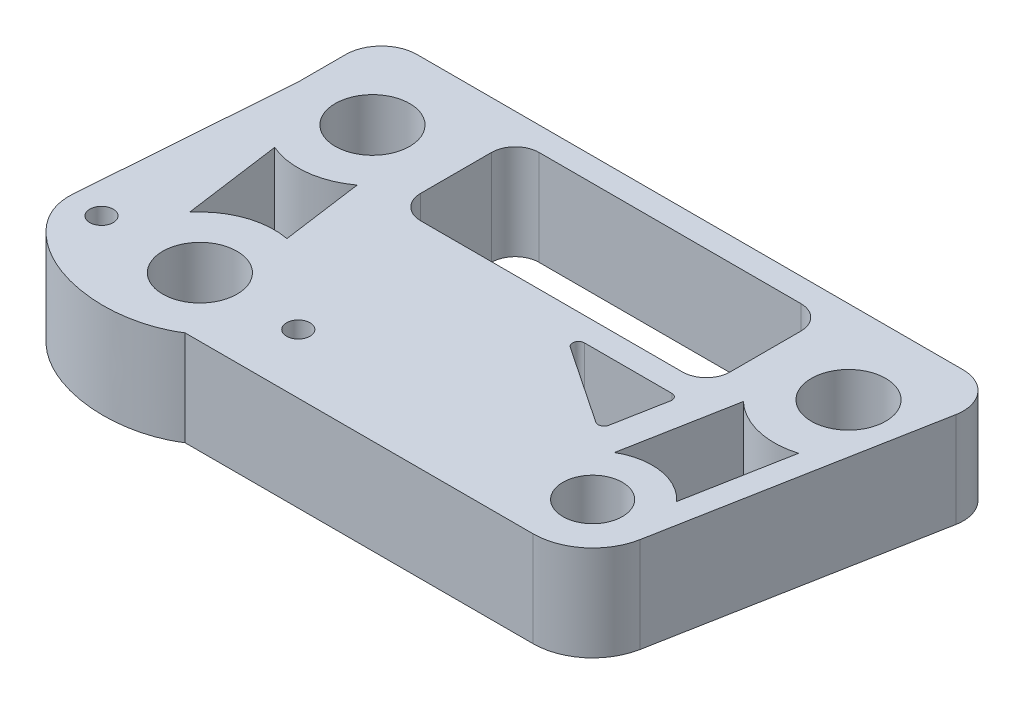
from build123d import *

# Parameters (mm, degrees)
SKETCH4_R           = 3.96875
SKETCH4_R_2         = 3.175
SKETCH4_R_3         = 1.25
BOSS_EXTRUDE2_DEPTH = 10.16
SKETCH6_R           = 5.05
CUT_EXTRUDE1_DEPTH  = 3.3
FILLET1_R           = 3.81


with BuildPart() as part:
    # Sketch4 → Boss-Extrude2 (new body)
    with BuildSketch(Plane(origin=(0, 0, 0), x_dir=(1, 0, 0), z_dir=(0, 1, 0))):
        with BuildLine():
            Line((54.2925, 31.75), (-12.3825, 31.75))
            Line((-12.3825, 31.75), (-12.3825, 22.86))
            Line((-12.3825, 22.86), (-14.03894274, 0.53216308))
            add(Edge.make_bspline(
                [(-14.03894274, 0.53216308), (-14.196581641, -1.592713076), (-10.175970279, -8.364307775), (0.040816901, -9.386271273), (4.7625, -6.35)],
                knots=[0, 0, 0, 0, 0.247792149, 1, 1, 1, 1], degree=3))
            Line((4.7625, -6.35), (41.91, -6.35))
            ThreePointArc((41.91, -6.35), (45.967580476, -4.884520517), (48.152310263, -1.164501002))
            Line((48.152310263, -1.164501002), (54.2925, 31.75))
        make_face()
        Circle(SKETCH4_R, mode=Mode.SUBTRACT)
        with Locations((46.355, 22.86)):
            Circle(SKETCH4_R, mode=Mode.SUBTRACT)
        with Locations((-4.445, 22.86)):
            Circle(SKETCH4_R, mode=Mode.SUBTRACT)
        with Locations((41.91, 0)):
            Circle(SKETCH4_R_2, mode=Mode.SUBTRACT)
        with Locations((10.5, 0)):
            Circle(SKETCH4_R_3, mode=Mode.SUBTRACT)
        with Locations((-10.5, 0)):
            Circle(SKETCH4_R_3, mode=Mode.SUBTRACT)
        with BuildLine():
            Line((34.925, 29.21), (6.985, 29.21))
            ThreePointArc((6.985, 29.21), (5.188948776, 28.466051224), (4.445, 26.67))
            Line((4.445, 26.67), (4.445, 19.1135))
            ThreePointArc((4.445, 19.1135), (5.188948776, 17.317448776), (6.985, 16.5735))
            Line((6.985, 16.5735), (34.925, 16.5735))
            ThreePointArc((34.925, 16.5735), (36.721051224, 17.317448776), (37.465, 19.1135))
            Line((37.465, 19.1135), (37.465, 26.67))
            ThreePointArc((37.465, 26.67), (36.721051224, 28.466051224), (34.925, 29.21))
        make_face(mode=Mode.SUBTRACT)
        with BuildLine():
            Line((46.58698696, 4.295147609), (48.631735848, 15.256028661))
            ThreePointArc((48.631735848, 15.256028661), (44.519378774, 15.137668683), (40.900146495, 17.093850549))
            Line((40.900146495, 17.093850549), (38.737442476, 5.500670755))
            ThreePointArc((38.737442476, 5.500670755), (42.873923491, 6.276412312), (46.58698696, 4.295147609))
        make_face(mode=Mode.SUBTRACT)
        with BuildLine():
            Line((-6.14066773, 5.029523445), (-7.591897143, 15.572960504))
            ThreePointArc((-7.591897143, 15.572960504), (-3.525796009, 14.975903966), (0.293891225, 16.492361803))
            Line((0.293891225, 16.492361803), (1.490851578, 7.796234208))
            ThreePointArc((1.490851578, 7.796234208), (-2.705340953, 7.462240721), (-6.14066773, 5.029523445))
        make_face(mode=Mode.SUBTRACT)
        with BuildLine():
            Line((35.921478098, 7.718896983), (36.959282513, 13.2820499))
            ThreePointArc((36.959282513, 13.2820499), (36.823503538, 13.804258048), (36.335051487, 14.0335))
            Line((36.335051487, 14.0335), (27.003423807, 14.0335))
            ThreePointArc((27.003423807, 14.0335), (26.395931126, 13.583371961), (26.649696678, 12.871146117))
            Line((26.649696678, 12.871146117), (34.943519943, 7.307993201))
            ThreePointArc((34.943519943, 7.307993201), (35.543221805, 7.249922938), (35.921478098, 7.718896983))
        make_face(mode=Mode.SUBTRACT)
    extrude(amount=BOSS_EXTRUDE2_DEPTH)

    # Sketch6 → Cut-Extrude1 (cut)
    with BuildSketch(Plane.XZ):
        Circle(SKETCH6_R)
    extrude(amount=-CUT_EXTRUDE1_DEPTH, mode=Mode.SUBTRACT)

    # Fillet1
    fillet1_edges = [part.edges().sort_by_distance(p)[0] for p in [
        (54.2925, 5.08, -31.75),
        (-12.3825, 5.08, -31.75),
    ]]
    fillet(fillet1_edges, radius=FILLET1_R)


solid = part.part
